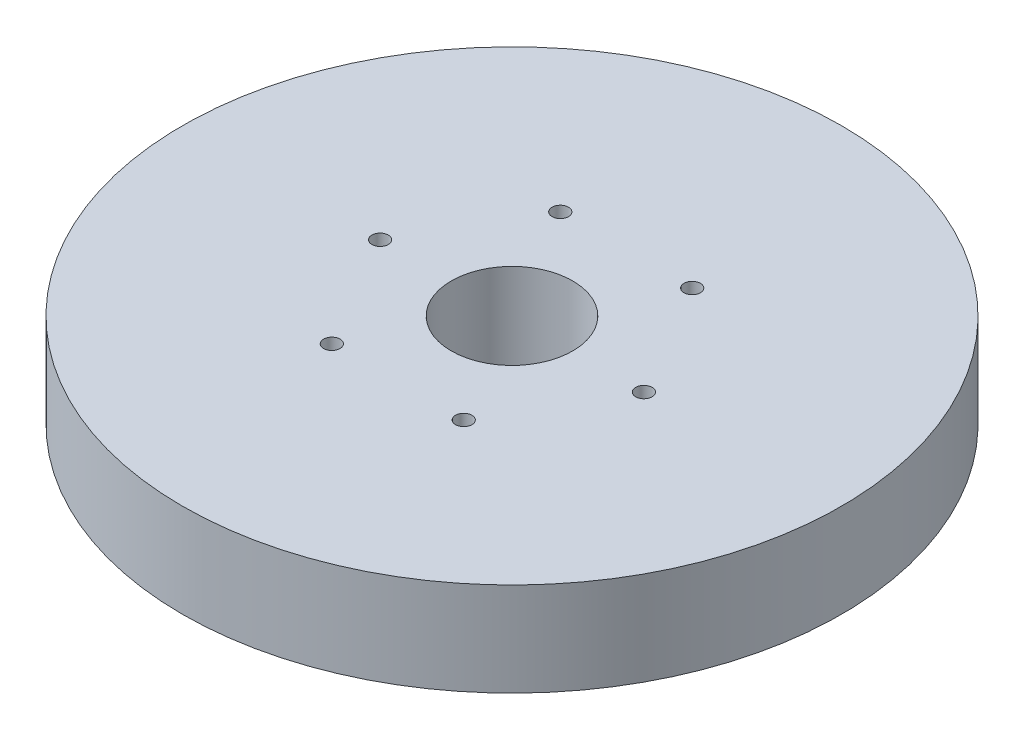
from build123d import *

# Parameters (mm, degrees)
SKETCH1_R           = 95
BOSS_EXTRUDE1_DEPTH = 27
SKETCH2_R           = 17.5
CUT_EXTRUDE1_DEPTH  = 138.03649149
SKETCH3_R           = 2.368500587
CUT_EXTRUDE2_DEPTH  = 16.79588057
CIRPATTERN1_COUNT   = 6


with BuildPart() as part:
    # Sketch1 → Boss-Extrude1 (new body)
    with BuildSketch(Plane(origin=(0, 0, 0), x_dir=(1, 0, 0), z_dir=(0, 1, 0))):
        Circle(SKETCH1_R)
    extrude(amount=BOSS_EXTRUDE1_DEPTH)

    # Sketch2 → Cut-Extrude1 (cut, through all)
    with BuildSketch(Plane(origin=(0, 0, 0), x_dir=(1, 0, 0), z_dir=(0, 1, 0))):
        Circle(SKETCH2_R)
    extrude(amount=CUT_EXTRUDE1_DEPTH, mode=Mode.SUBTRACT)

    # Sketch3 → Cut-Extrude2 (cut)
    with BuildSketch(Plane(origin=(0, 27, 0), x_dir=(1, 0, 0), z_dir=(0, 1, 0))):
        with Locations((-38.023879586, 0)):
            Circle(SKETCH3_R)
    cut_extrude2 = extrude(amount=-CUT_EXTRUDE2_DEPTH, mode=Mode.SUBTRACT)

    # CirPattern1: Cut-Extrude2 ×6 about axis
    cirpattern1_axis = Axis((0, 0, 0), (0, 1, 0))
    for i in range(1, CIRPATTERN1_COUNT):
        add(cut_extrude2.rotate(cirpattern1_axis, i * 360 / CIRPATTERN1_COUNT), mode=Mode.SUBTRACT)


solid = part.part
